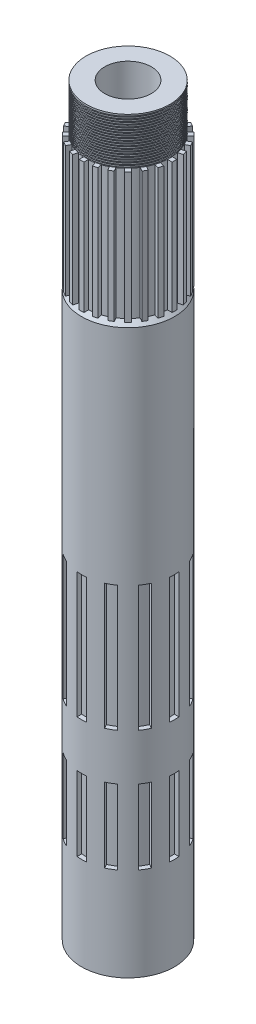
from build123d import *
from build123d.topology import SkipClean

# Parameters (mm, degrees)
CUT_EXTRUDE1_REACH        = 163.624
CUT_EXTRUDE1_START_RADIUS = 10
CUT_EXTRUDE1_END_RADIUS   = 10
SKETCH2_W                 = 16
SKETCH2_H                 = 2
SKETCH2_W_2               = 27
CIRPATTERN1_COUNT         = 12
SKETCH5_W                 = 28
SKETCH5_H                 = 1
BOSS_EXTRUDE3_DEPTH       = 2.99
CIRPATTERN3_COUNT         = 24
THREAD1_PITCH             = 0.5


with BuildPart() as part:
    # Sketch1 → Revolve1 (revolve)
    with BuildSketch(Plane.YZ, mode=Mode.PRIVATE) as revolve1_sk:
        Polygon((0, 10), (0, 4), (137.5, 4), (137.5, 5), (160, 5), (160, 9), (122, 9), (121, 10), align=None)
    revolve(revolve1_sk.sketch.rotate(Axis((0, -77.459860265, 0), (0, 1, 0)), 180), axis=Axis((0, -77.459860265, 0), (0, 1, 0)))

    # Cut-Extrude1: from a cylinder face, 163.624 long prism both ways, kept between that surface and its translate by the depth
    cut_extrude1_start = Plane(origin=(0, 43.75, 0), z_dir=(0, -1, 0)) * Cylinder(CUT_EXTRUDE1_START_RADIUS, 379.748, mode=Mode.PRIVATE)
    cut_extrude1_end = Plane(origin=(-1, 43.75, 0), z_dir=(0, -1, 0)) * Cylinder(CUT_EXTRUDE1_END_RADIUS, 379.748, mode=Mode.PRIVATE)
    # Sketch2 → Cut-Extrude1 (cut, from a surface)
    with BuildSketch(Plane.YZ, mode=Mode.PRIVATE) as cut_extrude1_sk1:
        with Locations((28, 0)):
            Rectangle(SKETCH2_W, SKETCH2_H)
    cut_extrude1_tool1 = extrude(cut_extrude1_sk1.sketch, amount=CUT_EXTRUDE1_REACH, both=True, mode=Mode.PRIVATE)
    # Sketch2 → Cut-Extrude1 (cut, from a surface)
    with BuildSketch(Plane.YZ, mode=Mode.PRIVATE) as cut_extrude1_sk2:
        with Locations((59.5, 0)):
            Rectangle(SKETCH2_W_2, SKETCH2_H)
    cut_extrude1_tool2 = extrude(cut_extrude1_sk2.sketch, amount=CUT_EXTRUDE1_REACH, both=True, mode=Mode.PRIVATE)
    cut_extrude1 = ((cut_extrude1_tool1 & cut_extrude1_start) - cut_extrude1_end).solids().sort_by_distance((9.449874, 28, 0))[0] + ((cut_extrude1_tool2 & cut_extrude1_start) - cut_extrude1_end).solids().sort_by_distance((9.449874, 28, 0))[0]
    add(cut_extrude1, mode=Mode.SUBTRACT)

    # CirPattern1: Cut-Extrude1 ×12 about axis
    cirpattern1_axis = Axis((0, 0, 0), (0, 1, 0))
    for i in range(1, CIRPATTERN1_COUNT):
        add(cut_extrude1.rotate(cirpattern1_axis, i * 360 / CIRPATTERN1_COUNT), mode=Mode.SUBTRACT)

    # Sketch5 → Boss-Extrude3 (add)
    with BuildSketch(Plane.YZ.offset(7)):
        with Locations((136, 0)):
            Rectangle(SKETCH5_W, SKETCH5_H)
    boss_extrude3 = extrude(amount=BOSS_EXTRUDE3_DEPTH)

    # CirPattern3: Boss-Extrude3 ×24 about axis
    cirpattern3_axis = Axis((0, 0, 0), (0, 1, 0))
    for i in range(1, CIRPATTERN3_COUNT):
        add(boss_extrude3.rotate(cirpattern3_axis, i * 360 / CIRPATTERN3_COUNT))

    # Thread1: the profile of Thread Profile1 profile screwed along a right-hand helix of 20 turns, 6 arcs to a turn; built about Z, then put on its axis
    with SkipClean():  # the faces are left unmerged after this step: merging them gives an invalid solid
        thread1_z = Axis((0, 0, 0), (0, 0, 1))
        thread1_corners = [(9.0003, 0, -0.000173205), (9.0003, 0, 0.218923204), (8.864683531, 0, 0.140625), (8.864683531, 0, 0.078125)]
        with BuildLine(mode=Mode.PRIVATE) as thread1_profile:
            Line(thread1_corners[0], thread1_corners[1])
            Line(thread1_corners[1], thread1_corners[2])
            Line(thread1_corners[2], thread1_corners[3])
            Line(thread1_corners[3], thread1_corners[0])
        thread1_cap = Face(thread1_profile.wire())
        thread1_turn_angles = [0, 30, 60, 90, 120, 150, 180, 210, 240, 270, 300, 330, 360]
        thread1_turn_weights = [1, 0.8660254037844387, 1, 0.8660254037844387, 1, 0.8660254037844387, 1, 0.8660254037844387, 1, 0.8660254037844387, 1, 0.8660254037844387, 1]
        thread1_turn_rails = [Edge.make_bspline([Vector(p[0], p[1], 0).rotate(thread1_z, thread1_turn_angles[k]) / thread1_turn_weights[k] + Vector(0, 0, p[2] + THREAD1_PITCH * thread1_turn_angles[k] / 360) for k in range(13)], [0, 0, 0, 1, 1, 2, 2, 3, 3, 4, 4, 5, 5, 6, 6, 6], 2, thread1_turn_weights) for p in thread1_corners]
        thread1_turn_sides = [Face.make_surface_from_curves(thread1_turn_rails[p[0]], thread1_turn_rails[p[1]]) for p in [(0, 1), (1, 2), (2, 3), (3, 0)]]
        thread1 = Plane(origin=(0, 160, 0), x_dir=(-1, 0, 0), z_dir=(0, -1, 0)) * Solid(Shell([*[p.moved(Location((0, 0, THREAD1_PITCH * i))) for i in range(20) for p in thread1_turn_sides], thread1_cap, thread1_cap.rotate(thread1_z, 7200).moved(Location((0, 0, THREAD1_PITCH * 7200 / 360)))]))
        add(thread1, mode=Mode.SUBTRACT)


solid = part.part
